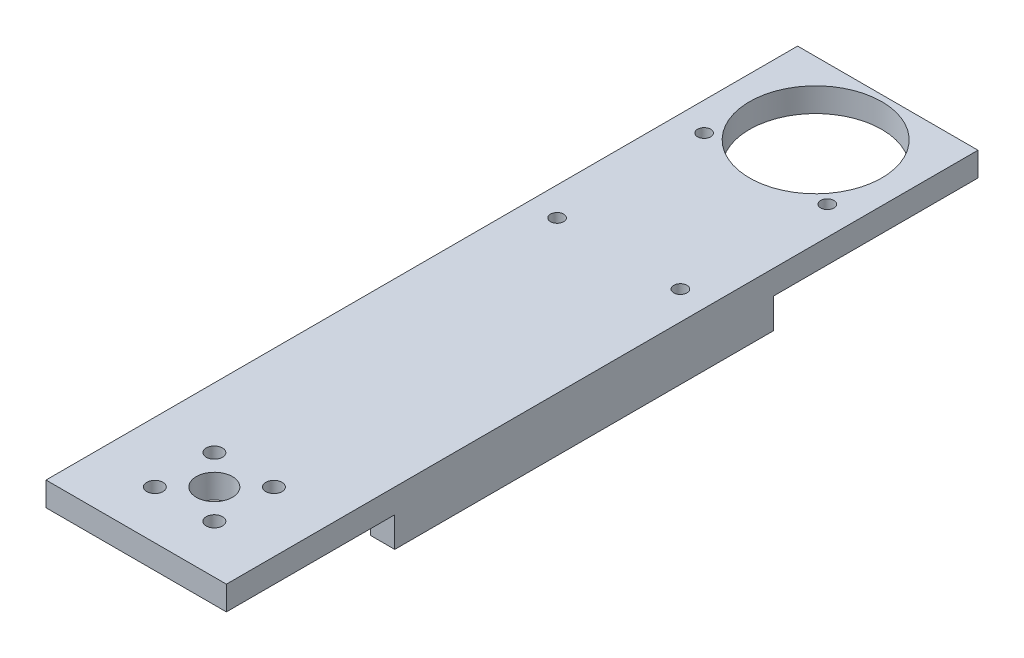
from build123d import *

# Parameters (mm, degrees)
S_BOX1_W      = 30
S_BOX1_H      = 4
BOSS_1_DEPTH  = 125
S_BOX2_W      = 4
S_BOX2_H      = 5.5
BOSS_2_DEPTH  = 63
S_BOX3_W      = 4
S_BOX3_H      = 5.5
BOSS_3_DEPTH  = 63
S_HOLE4_R     = 3
HOLE_4_DEPTH  = 4.2
S_HOLE5_R     = 1.35
HOLE_5_DEPTH  = 4.2
S_HOLE6_R     = 1.35
HOLE_6_DEPTH  = 4.2
S_HOLE7_R     = 1.35
HOLE_7_DEPTH  = 4.2
S_HOLE8_R     = 1.35
HOLE_8_DEPTH  = 4.2
S_HOLE9_R     = 11
HOLE_9_DEPTH  = 4.2
S_HOLE10_R    = 1.1
HOLE_10_DEPTH = 4.2
S_HOLE11_R    = 1.1
HOLE_11_DEPTH = 4.2
S_HOLE12_R    = 1.1
HOLE_12_DEPTH = 4.2
S_HOLE13_R    = 1.1
HOLE_13_DEPTH = 4.2


with BuildPart() as part:
    # S_box1 → Boss_1 (new body)
    with BuildSketch(Plane.XY.offset(-112)):
        with Locations((0, -18)):
            Rectangle(S_BOX1_W, S_BOX1_H)
    extrude(amount=BOSS_1_DEPTH)

    # S_box2 → Boss_2 (add)
    with BuildSketch(Plane.XY.offset(-78)):
        with Locations((-13, -22.25)):
            Rectangle(S_BOX2_W, S_BOX2_H)
    extrude(amount=BOSS_2_DEPTH)

    # S_box3 → Boss_3 (add)
    with BuildSketch(Plane.XY.offset(-78)):
        with Locations((13, -22.25)):
            Rectangle(S_BOX3_W, S_BOX3_H)
    extrude(amount=BOSS_3_DEPTH)

    # S_hole4 → Hole_4 (cut)
    with BuildSketch(Plane(origin=(0, -20.1, 0), x_dir=(1, 0, 0), z_dir=(0, 1, 0))):
        Circle(S_HOLE4_R)
    extrude(amount=HOLE_4_DEPTH, mode=Mode.SUBTRACT)

    # S_hole5 → Hole_5 (cut)
    with BuildSketch(Plane(origin=(0, -20.1, 0), x_dir=(1, 0, 0), z_dir=(0, 1, 0))):
        with Locations((4.949747468, -4.949747468)):
            Circle(S_HOLE5_R)
    extrude(amount=HOLE_5_DEPTH, mode=Mode.SUBTRACT)

    # S_hole6 → Hole_6 (cut)
    with BuildSketch(Plane(origin=(0, -20.1, 0), x_dir=(1, 0, 0), z_dir=(0, 1, 0))):
        with Locations((-4.949747468, -4.949747468)):
            Circle(S_HOLE6_R)
    extrude(amount=HOLE_6_DEPTH, mode=Mode.SUBTRACT)

    # S_hole7 → Hole_7 (cut)
    with BuildSketch(Plane(origin=(0, -20.1, 0), x_dir=(1, 0, 0), z_dir=(0, 1, 0))):
        with Locations((-4.949747468, 4.949747468)):
            Circle(S_HOLE7_R)
    extrude(amount=HOLE_7_DEPTH, mode=Mode.SUBTRACT)

    # S_hole8 → Hole_8 (cut)
    with BuildSketch(Plane(origin=(0, -20.1, 0), x_dir=(1, 0, 0), z_dir=(0, 1, 0))):
        with Locations((4.949747468, 4.949747468)):
            Circle(S_HOLE8_R)
    extrude(amount=HOLE_8_DEPTH, mode=Mode.SUBTRACT)

    # S_hole9 → Hole_9 (cut)
    with BuildSketch(Plane(origin=(0, -20.1, 0), x_dir=(1, 0, 0), z_dir=(0, 1, 0))):
        with Locations((0, 100)):
            Circle(S_HOLE9_R)
    extrude(amount=HOLE_9_DEPTH, mode=Mode.SUBTRACT)

    # S_hole10 → Hole_10 (cut)
    with BuildSketch(Plane(origin=(0, -20.1, 0), x_dir=(1, 0, 0), z_dir=(0, 1, 0))):
        with Locations((-10.25, 91.7)):
            Circle(S_HOLE10_R)
    extrude(amount=HOLE_10_DEPTH, mode=Mode.SUBTRACT)

    # S_hole11 → Hole_11 (cut)
    with BuildSketch(Plane(origin=(0, -20.1, 0), x_dir=(1, 0, 0), z_dir=(0, 1, 0))):
        with Locations((10.25, 91.7)):
            Circle(S_HOLE11_R)
    extrude(amount=HOLE_11_DEPTH, mode=Mode.SUBTRACT)

    # S_hole12 → Hole_12 (cut)
    with BuildSketch(Plane(origin=(0, -20.1, 0), x_dir=(1, 0, 0), z_dir=(0, 1, 0))):
        with Locations((-10.25, 67.25)):
            Circle(S_HOLE12_R)
    extrude(amount=HOLE_12_DEPTH, mode=Mode.SUBTRACT)

    # S_hole13 → Hole_13 (cut)
    with BuildSketch(Plane(origin=(0, -20.1, 0), x_dir=(1, 0, 0), z_dir=(0, 1, 0))):
        with Locations((10.25, 67.25)):
            Circle(S_HOLE13_R)
    extrude(amount=HOLE_13_DEPTH, mode=Mode.SUBTRACT)


solid = part.part
